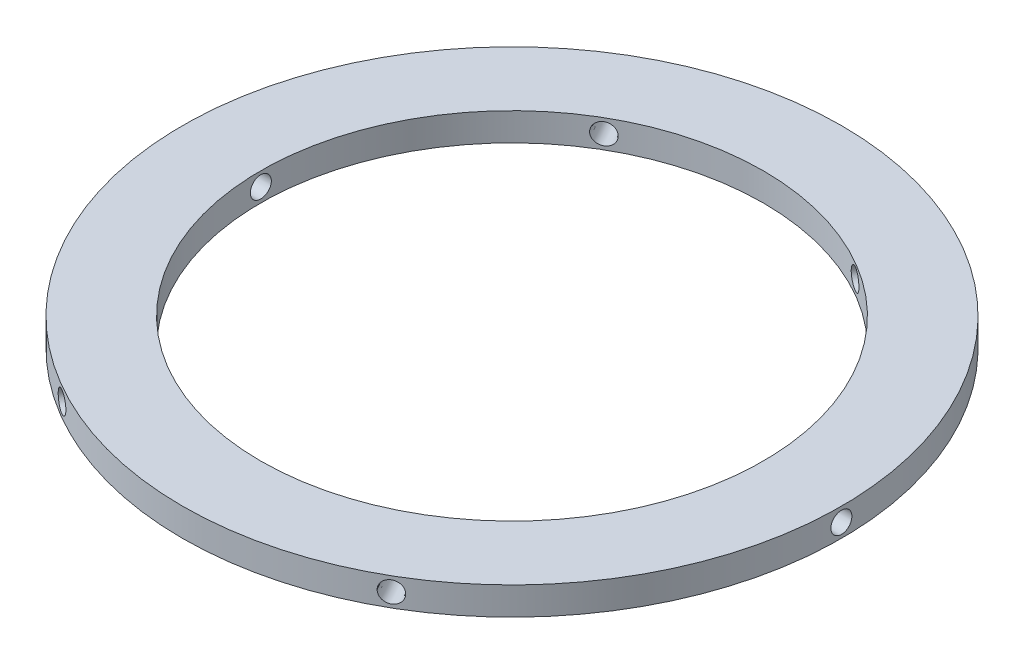
from build123d import *

# Parameters (mm, degrees)
SKETCH1_R           = 74.93
SKETCH1_R_2         = 57.15
BOSS_EXTRUDE1_DEPTH = 6.35
CUT_EXTRUDE1_START  = 57.100368974
CUT_EXTRUDE1_DEPTH  = 17.829631087
CIRPATTERN1_COUNT   = 6


# Read off the part's stored shape, not the designer's step: Cut-Extrude1
with BuildPart() as part:
    # Sketch1 → Boss-Extrude1 (new body)
    with BuildSketch(Plane(origin=(0, 0, -13.767833252), x_dir=(1, 0, 0), z_dir=(0, 1, 0))):
        with Locations(Location((0, -13.767833252, 0), (0, 0, 270))):
            Circle(SKETCH1_R)
        with Locations(Location((0, -13.767833252, 0), (0, 0, 270))):
            Circle(SKETCH1_R_2, mode=Mode.SUBTRACT)
    extrude(amount=BOSS_EXTRUDE1_DEPTH)

    # Cut-Extrude1 outline → Cut-Extrude1 (cut)
    with BuildSketch(Plane(origin=(0, 0, 0), x_dir=(0, 0, -1), z_dir=(1, 0, 0)).offset(CUT_EXTRUDE1_START)):
        with BuildLine():
            add(Edge.make_bspline(
                [(-2.38125, 3.175), (-2.38125, 2.545689765), (-2.123033278, 1.930357336), (-1.2442565, 1.051740378), (-0.62249036, 0.794081166), (0.619954121, 0.79341951), (1.238190075, 1.046043776), (2.127703619, 1.934658687), (2.381029238, 2.552537452), (2.381470462, 3.795772338), (2.124110632, 4.417632015), (1.2467502, 5.296696076), (0.63058667, 5.55561142), (-0.625754549, 5.556886128), (-1.242456014, 5.29943754), (-2.122452606, 4.420843788), (-2.38125, 3.804310235), (-2.38125, 3.175)],
                knots=[0, 0, 0, 0, 0.125, 0.125, 0.25, 0.25, 0.375, 0.375, 0.5, 0.5, 0.625, 0.625, 0.75, 0.75, 0.875, 0.875, 1, 1, 1, 1], degree=3))
        make_face()
    cut_extrude1 = extrude(amount=CUT_EXTRUDE1_DEPTH, mode=Mode.SUBTRACT)

    # CirPattern1: Cut-Extrude1 ×6 about axis
    cirpattern1_axis = Axis((0, 6.35, 0), (0, 1, 0))
    for i in range(1, CIRPATTERN1_COUNT):
        add(cut_extrude1.rotate(cirpattern1_axis, i * 360 / CIRPATTERN1_COUNT), mode=Mode.SUBTRACT)


solid = part.part
